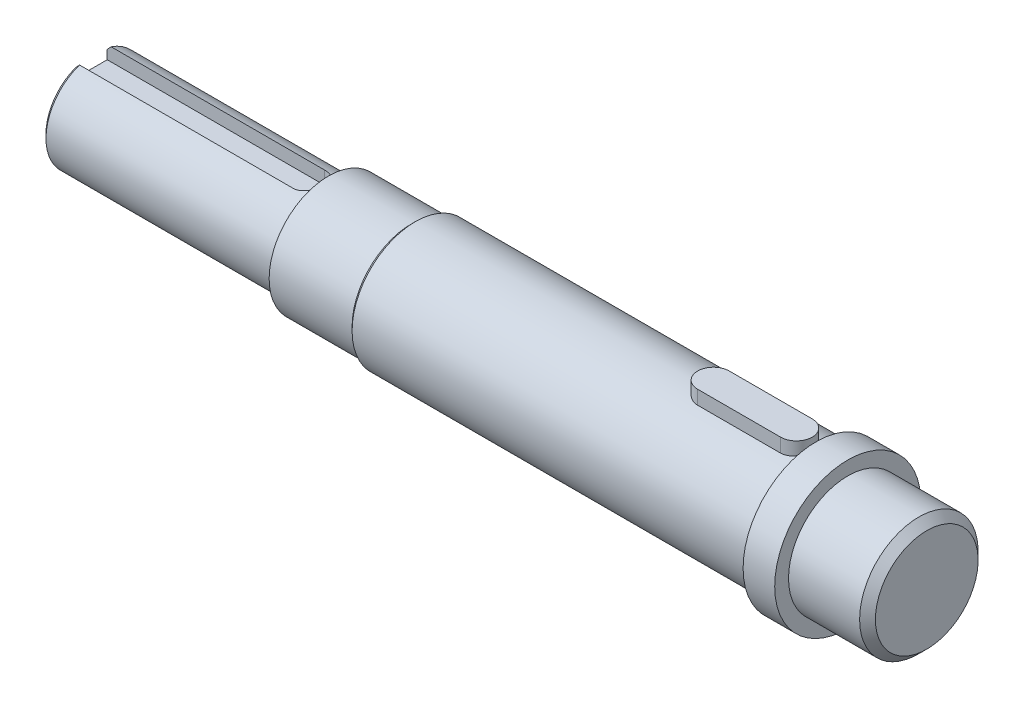
from build123d import *

# Parameters (mm, degrees)
CUT_EXTRUDE1_START  = 12.5
CUT_EXTRUDE1_DEPTH  = 4
CHAMFER1_SIZE       = 2
CUT_EXTRUDE2_START  = 16
CUT_EXTRUDE2_DEPTH  = 5
BOSS_EXTRUDE1_DEPTH = 8
CHAMFER2_SIZE       = 1


with BuildPart() as part:
    # Sketch1 → Revolve1 (revolve)
    with BuildSketch(Plane.XY, mode=Mode.PRIVATE) as revolve1_sk:
        Polygon((-74.088237147, 0), (-74.088237147, 11.5), (-73.088237147, 12.5), (-15.088237147, 12.5), (-14.088237147, 13.5), (-14.088237147, 15), (6.911762853, 15), (6.911762853, 16), (109.411762853, 16), (109.411762853, 18.5), (117.411762853, 18.5), (117.411762853, 15), (137.411762853, 15), (137.411762853, 0), align=None)
    revolve(revolve1_sk.sketch.rotate(Axis((-81.144259733, 0, 0), (1, 0, 0)), 90), axis=Axis((-81.144259733, 0, 0), (1, 0, 0)))

    # Sketch2 → Cut-Extrude1 (cut)
    with BuildSketch(Plane(origin=(0, 0, 0), x_dir=(1, 0, 0), z_dir=(0, 1, 0)).offset(CUT_EXTRUDE1_START)):
        with BuildLine():
            Line((-74.748728331, 4), (-19.088237147, 4))
            ThreePointArc((-19.088237147, 4), (-15.088237147, 0), (-19.088237147, -4))
            Line((-19.088237147, -4), (-74.748728331, -4))
            ThreePointArc((-74.748728331, -4), (-78.748728331, 0), (-74.748728331, 4))
        make_face()
    extrude(amount=-CUT_EXTRUDE1_DEPTH, mode=Mode.SUBTRACT)

    # Chamfer1
    chamfer1_edges = [part.edges().sort_by_distance(p)[0] for p in [
        (137.411762853, 0, -15),
    ]]
    chamfer(chamfer1_edges, length=CHAMFER1_SIZE)

    # Sketch3 → Cut-Extrude2 (cut)
    with BuildSketch(Plane(origin=(0, 0, 0), x_dir=(1, 0, 0), z_dir=(0, 1, 0)).offset(CUT_EXTRUDE2_START)):
        with BuildLine():
            Line((83.411762853, 4), (104.411762853, 4))
            ThreePointArc((104.411762853, 4), (108.411762853, 0), (104.411762853, -4))
            Line((104.411762853, -4), (83.411762853, -4))
            ThreePointArc((83.411762853, -4), (79.411762853, 0), (83.411762853, 4))
        make_face()
    extrude(amount=-CUT_EXTRUDE2_DEPTH, mode=Mode.SUBTRACT)

    # Chamfer2
    chamfer2_edges = [part.edges().sort_by_distance(p)[0] for p in [
        (6.911762853, 0, -16),
    ]]
    chamfer(chamfer2_edges, length=CHAMFER2_SIZE - 0.0001)  # a hair under: the kernel refuses the full size


with BuildPart() as body_2:
    # Sketch4 → Boss-Extrude1 (new body)
    with BuildSketch(Plane(origin=(0, 11, 0), x_dir=(1, 0, 0), z_dir=(0, 1, 0))):
        with BuildLine():
            Line((83.411762853, -4), (104.411762853, -4))
            ThreePointArc((104.411762853, -4), (108.411762853, 0), (104.411762853, 4))
            Line((104.411762853, 4), (83.411762853, 4))
            ThreePointArc((83.411762853, 4), (79.411762853, 0), (83.411762853, -4))
        make_face()
    extrude(amount=BOSS_EXTRUDE1_DEPTH)


solid = Compound([part.part, body_2.part])
